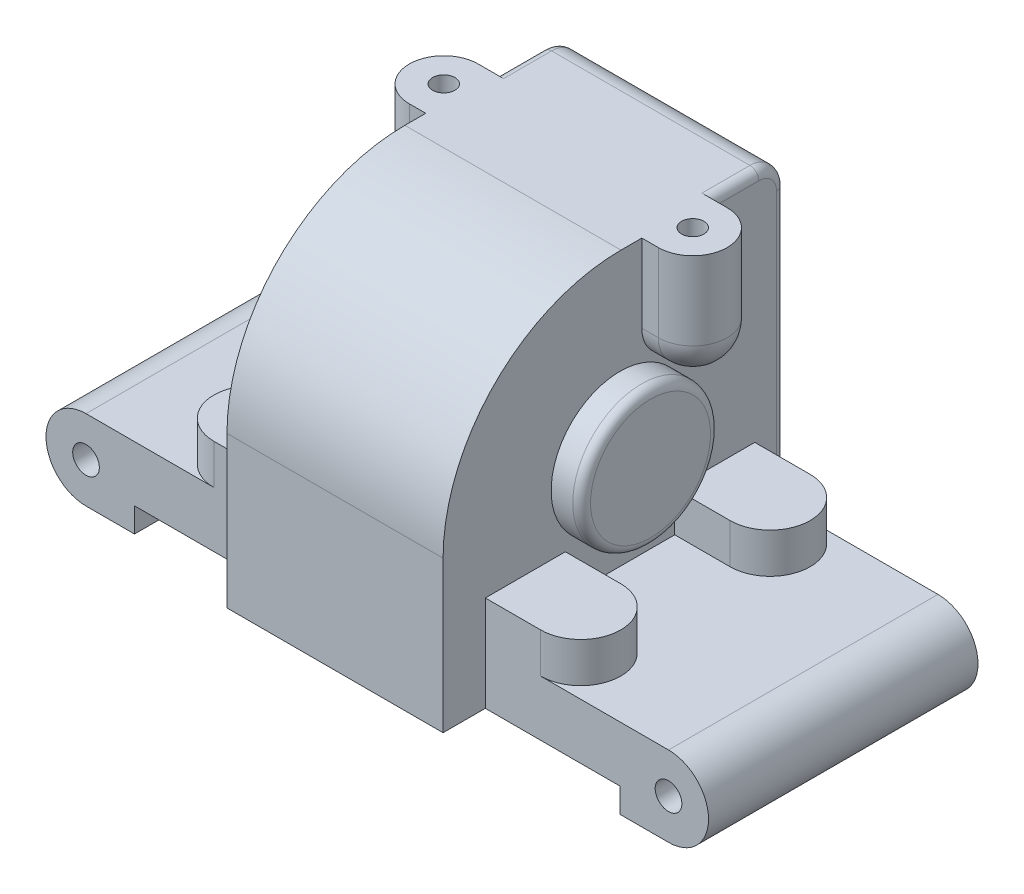
from build123d import *

# Parameters (mm, degrees)
SKETCH1_R           = 1.5
BOSS_EXTRUDE1_DEPTH = 30.3
BOSS_EXTRUDE2_DEPTH = 12.15
BOSS_EXTRUDE3_DEPTH = 12.66
FILLET1_R           = 3.875
BOSS_EXTRUDE4_DEPTH = 4.5
SKETCH5_R           = 1.25
CUT_EXTRUDE1_DEPTH  = 10
SKETCH6_R           = 7.75
BOSS_EXTRUDE5_DEPTH = 15.58
FILLET2_R           = 1
FILLET3_R           = 1
SKETCH7_R           = 2
CUT_EXTRUDE2_DEPTH  = 8


with BuildPart() as part:
    # Sketch1 → Boss-Extrude1 (new body)
    with BuildSketch(Plane.XY):
        with BuildLine():
            Line((27.3, -4.5), (32.75, -4.5))
            ThreePointArc((32.75, -4.5), (37.25, 0), (32.75, 4.5))
            Line((32.75, 4.5), (-32.75, 4.5))
            ThreePointArc((-32.75, 4.5), (-37.25, 0), (-32.75, -4.5))
            Line((-32.75, -4.5), (-27.3, -4.5))
            Line((-27.3, -4.5), (-27.3, -1.75))
            Line((-27.3, -1.75), (27.3, -1.75))
            Line((27.3, -1.75), (27.3, -4.5))
        make_face()
        with Locations(Location((-32.75, 0, 0), (0, 0, 180))):
            Circle(SKETCH1_R, mode=Mode.SUBTRACT)
        with Locations(Location((32.75, 0, 0), (0, 0, 180))):
            Circle(SKETCH1_R, mode=Mode.SUBTRACT)
    extrude(amount=BOSS_EXTRUDE1_DEPTH)

    # Sketch2 → Boss-Extrude2 (add, symmetric)
    with BuildSketch(Plane(origin=(0, 0, 0), x_dir=(0, 0, -1), z_dir=(1, 0, 0))):
        with BuildLine():
            Line((-35.05, -1.75), (3.45, -1.75))
            Line((3.45, -1.75), (3.45, 32.25))
            ThreePointArc((3.45, 32.25), (2.571320344, 34.371320344), (0.45, 35.25))
            Line((0.45, 35.25), (-15.05, 35.25))
            ThreePointArc((-15.05, 35.25), (-29.192135624, 29.392135624), (-35.05, 15.25))
            Line((-35.05, 15.25), (-35.05, -1.75))
        make_face()
    extrude(amount=BOSS_EXTRUDE2_DEPTH, both=True)

    # Sketch3 → Boss-Extrude3 (add)
    with BuildSketch(Plane(origin=(0, 35.25, 0), x_dir=(1, 0, 0), z_dir=(0, 1, 0))):
        with BuildLine():
            Line((14, -12.7), (-14, -12.7))
            ThreePointArc((-14, -12.7), (-17.875, -8.825), (-14, -4.95))
            Line((-14, -4.95), (14, -4.95))
            ThreePointArc((14, -4.95), (17.875, -8.825), (14, -12.7))
        make_face()
    extrude(amount=-BOSS_EXTRUDE3_DEPTH)

    # Fillet1
    fillet1_edges = [part.edges().sort_by_distance(p)[0] for p in [
        (-13.075, 22.59, 4.95),
        (-13.075, 22.59, 12.7),
        (13.075, 22.59, 12.7),
        (13.075, 22.59, 4.95),
        (-17.875, 22.59, 8.825),
        (17.875, 22.59, 8.825),
    ]]
    fillet(fillet1_edges, radius=FILLET1_R - 0.0001)  # a hair under: the kernel refuses the full size

    # Sketch4 → Boss-Extrude4 (add)
    with BuildSketch(Plane(origin=(0, 4.5, 0), x_dir=(1, 0, 0), z_dir=(0, 1, 0))):
        with BuildLine():
            Line((-18.375, 0), (18.375, 0))
            ThreePointArc((18.375, 0), (22.875, -4.5), (18.375, -9))
            Line((18.375, -9), (-18.375, -9))
            ThreePointArc((-18.375, -9), (-22.875, -4.5), (-18.375, 0))
        make_face()
        with BuildLine():
            Line((18.375, -30.3), (-18.375, -30.3))
            ThreePointArc((-18.375, -30.3), (-22.875, -25.8), (-18.375, -21.3))
            Line((-18.375, -21.3), (18.375, -21.3))
            ThreePointArc((18.375, -21.3), (22.875, -25.8), (18.375, -30.3))
        make_face()
    extrude(amount=BOSS_EXTRUDE4_DEPTH)

    # Sketch5 → Cut-Extrude1 (cut)
    with BuildSketch(Plane(origin=(0, 35.25, 0), x_dir=(1, 0, 0), z_dir=(0, 1, 0))):
        with Locations(Location((14, -8.825, 0), (0, 0, 270))):
            Circle(SKETCH5_R)
        with Locations(Location((-14, -8.825, 0), (0, 0, 270))):
            Circle(SKETCH5_R)
    extrude(amount=-CUT_EXTRUDE1_DEPTH, mode=Mode.SUBTRACT)

    # Sketch6 → Boss-Extrude5 (add, symmetric)
    with BuildSketch(Plane(origin=(0, 0, 0), x_dir=(0, 0, -1), z_dir=(1, 0, 0))):
        with Locations((-15.15, 15.75)):
            Circle(SKETCH6_R)
    extrude(amount=BOSS_EXTRUDE5_DEPTH, both=True)

    # Fillet2
    fillet2_edges = [part.edges().sort_by_distance(p)[0] for p in [
        (-15.58, 15.75, 22.9),
        (15.58, 15.75, 22.9),
    ]]
    fillet(fillet2_edges, radius=FILLET2_R)

    # Fillet3
    fillet3_edges = [part.edges().sort_by_distance(p)[0] for p in [
        (-12.15, 15.25, -3.45),
        (-12.15, 34.371320344, -2.571320344),
        (-12.15, 35.25, 2.25),
        (12.15, 15.25, -3.45),
        (12.15, 34.371320344, -2.571320344),
        (12.15, 35.25, 2.25),
    ]]
    fillet(fillet3_edges, radius=FILLET3_R)

    # Sketch7 → Cut-Extrude2 (cut)
    with BuildSketch(Plane.XZ.offset(1.75)):
        with Locations(Location((-19, 5.2, 0), (0, 0, 270))):
            Circle(SKETCH7_R)
        with Locations(Location((-19, 25.2, 0), (0, 0, 270))):
            Circle(SKETCH7_R)
        with Locations(Location((19, 5.2, 0), (0, 0, 90))):
            Circle(SKETCH7_R)
        with Locations(Location((19, 25.2, 0), (0, 0, 90))):
            Circle(SKETCH7_R)
    extrude(amount=-CUT_EXTRUDE2_DEPTH, mode=Mode.SUBTRACT)


solid = part.part
